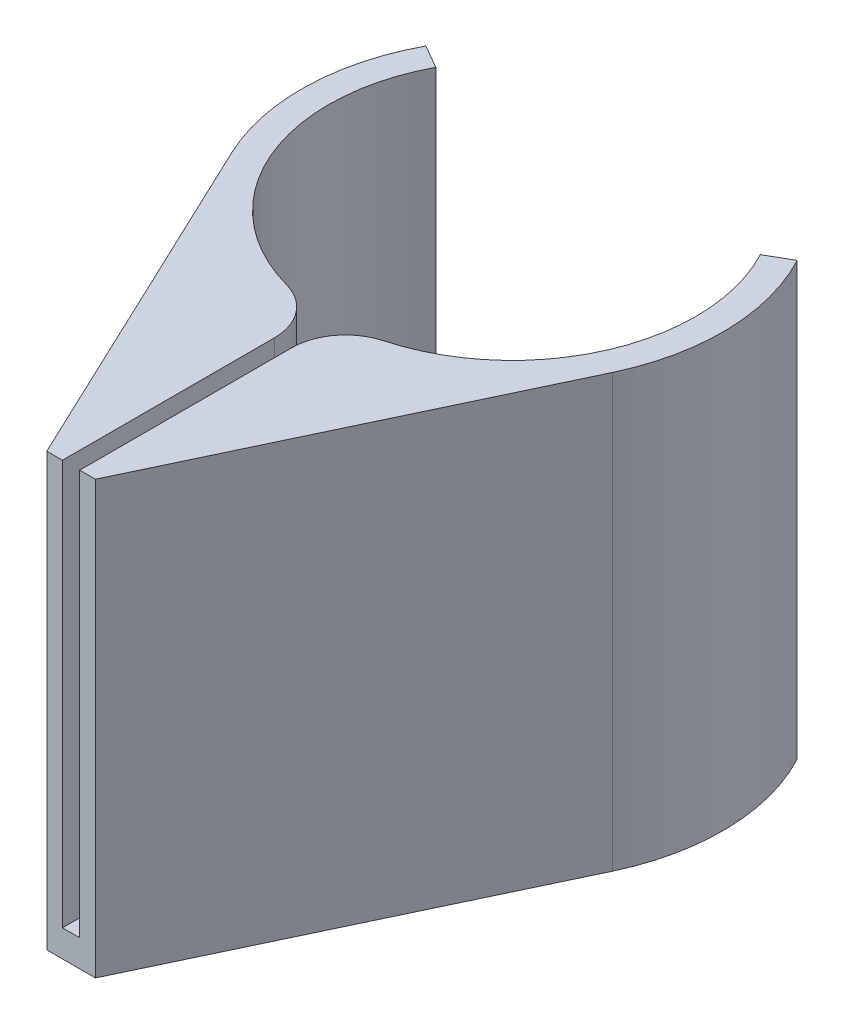
from build123d import *

# Parameters (mm, degrees)
FIN_SLOT_EXTRUDE_DEPTH = 80
FIN_START              = -75
FIN_SLOT_DEPTH         = 75
FILLET1_R              = 10


with BuildPart() as part:
    # Sketch2 → Fin slot extrude (new body)
    with BuildSketch(Plane(origin=(0, 0, 0), x_dir=(1, 0, 0), z_dir=(0, 1, 0))):
        with BuildLine():
            Line((-35.253910446, -16.678183302), (-4.5, -81.685))
            Line((-4.5, -81.685), (4.5, -81.685))
            Line((4.5, -81.685), (35.253910446, -16.678183302))
            ThreePointArc((35.253910446, -16.678183302), (38.987980591, 0.968178408), (34.382638025, 18.407449646))
            Line((34.382638025, 18.407449646), (30.049957519, 15.90597539))
            ThreePointArc((30.049957519, 15.90597539), (0, -34), (-30.049957519, 15.90597539))
            Line((-30.049957519, 15.90597539), (-34.382638025, 18.407449646))
            ThreePointArc((-34.382638025, 18.407449646), (-38.987980591, 0.968178408), (-35.253910446, -16.678183302))
        make_face()
    extrude(amount=FIN_SLOT_EXTRUDE_DEPTH)

    # Sketch3 → Fin slot (cut)
    with BuildSketch(Plane(origin=(0, 80, 0), x_dir=(1, 0, 0), z_dir=(0, 1, 0)).offset(FIN_START)):
        with BuildLine():
            Line((1.6, -81.685), (1.6, -33.962332075))
            ThreePointArc((1.6, -33.962332075), (0, -34), (-1.6, -33.962332075))
            Line((-1.6, -33.962332075), (-1.6, -81.685))
            Line((-1.6, -81.685), (1.6, -81.685))
        make_face()
    extrude(amount=FIN_SLOT_DEPTH, mode=Mode.SUBTRACT)

    # Fillet1
    # the kernel refuses this fillet: 10 mm, written as the material it takes off along each edge
    with BuildSketch(Plane(origin=(-1.6, 5, 33.962332075), x_dir=(0, 0, 1), z_dir=(0, 1, 0))) as fillet1_piece_1:
        with BuildLine():
            CenterArc((8.481041966, -10), FILLET1_R, 90, 74.714058958)
            Line((-1.165179407, -7.363636364), (-1.358103835, -7.310909091))
            ThreePointArc((-1.358103835, -7.310909091), (-0.577691759, -3.682593204), (-0.199778424, 0.009411765))
            Line((-0.199778424, 0.009411765), (0, 0.2))
            Line((0, 0.2), (8.481041966, 0.2))
            Line((8.481041966, 0.2), (8.481041966, 0))
        make_face()
    extrude(amount=75, mode=Mode.SUBTRACT)
    with BuildSketch(Plane(origin=(1.6, 5, 33.962332075), x_dir=(0, 0, 1), z_dir=(0, 1, 0))) as fillet1_piece_2:
        with BuildLine():
            CenterArc((8.481041966, 10), FILLET1_R, 195.285941042, 74.714058958)
            Line((-1.165179407, 7.363636364), (-1.358103835, 7.310909091))
            ThreePointArc((-1.358103835, 7.310909091), (-0.577691759, 3.682593204), (-0.199778424, -0.009411765))
            Line((-0.199778424, -0.009411765), (0, -0.2))
            Line((0, -0.2), (8.481041966, -0.2))
            Line((8.481041966, -0.2), (8.481041966, 0))
        make_face()
    extrude(amount=75, mode=Mode.SUBTRACT)
    with BuildSketch(Plane(origin=(0, 5, 0), x_dir=(0.7049632922211216, 0, 0.7092437920918008), z_dir=(0.7092437920918008, 0, -0.7049632922211216))) as fillet1_piece_3_section:
        with BuildLine():
            CenterArc((34 + FILLET1_R, FILLET1_R), FILLET1_R, 180, 90)
            Line((34, FILLET1_R), (34 - FILLET1_R * 0.02, FILLET1_R))
            Line((34 - FILLET1_R * 0.02, FILLET1_R), (34 - FILLET1_R * 0.02, -FILLET1_R * 0.02))
            Line((34 - FILLET1_R * 0.02, -FILLET1_R * 0.02), (34 + FILLET1_R, -FILLET1_R * 0.02))
            Line((34 + FILLET1_R, -FILLET1_R * 0.02), (34 + FILLET1_R, 0))
        make_face()
    fillet1_piece_3 = revolve(axis=Axis((0, 5, 0), (0, -1, 0)), revolution_arc=89.653157122, mode=Mode.PRIVATE)
    fillet1_piece_3 = split(fillet1_piece_3, bisect_by=Plane(origin=(1.6, 2.736001805, 36.252063161), z_dir=(-1, 0, 0)), keep=Keep.TOP, mode=Mode.PRIVATE)
    fillet1_piece_3 = split(fillet1_piece_3, bisect_by=Plane(origin=(-1.6, 2.736001805, 36.252063161), z_dir=(1, 0, 0)), keep=Keep.TOP, mode=Mode.PRIVATE)
    add(fillet1_piece_3, mode=Mode.SUBTRACT)
    with BuildSketch(Plane(origin=(0, 5, 0), x_dir=(0.7049632922211216, 0, 0.7092437920918008), z_dir=(0.7092437920918008, 0, -0.7049632922211216))) as fillet1_piece_4a_section:
        with BuildLine():
            CenterArc((34 + FILLET1_R, FILLET1_R), FILLET1_R, 180, 90)
            Line((34, FILLET1_R), (34 - FILLET1_R * 0.02, FILLET1_R))
            Line((34 - FILLET1_R * 0.02, FILLET1_R), (34 - FILLET1_R * 0.02, -FILLET1_R * 0.02))
            Line((34 - FILLET1_R * 0.02, -FILLET1_R * 0.02), (34 + FILLET1_R, -FILLET1_R * 0.02))
            Line((34 + FILLET1_R, -FILLET1_R * 0.02), (34 + FILLET1_R, 0))
        make_face()
    fillet1_piece_4a = revolve(axis=Axis((0, 5, 0), (0, -1, 0)), revolution_arc=89.653157122, mode=Mode.PRIVATE)
    fillet1_piece_4a = split(fillet1_piece_4a, bisect_by=Plane(origin=(-1.6, 2.81629174, 32.584573329), z_dir=(-1, 0, 0)), keep=Keep.TOP, mode=Mode.PRIVATE)
    with BuildSketch(Plane(origin=(-1.6, -16.202604914, 33.962332075), x_dir=(0, 0, 1), z_dir=(0, 1, 0))) as fillet1_piece_4b_section:
        with BuildLine():
            CenterArc((8.481041966, -10), FILLET1_R, 90, 74.714058958)
            Line((-1.165179407, -7.363636364), (-1.358103835, -7.310909091))
            ThreePointArc((-1.358103835, -7.310909091), (-0.577691759, -3.682593204), (-0.199778424, 0.009411765))
            Line((-0.199778424, 0.009411765), (0, 0.2))
            Line((0, 0.2), (8.481041966, 0.2))
            Line((8.481041966, 0.2), (8.481041966, 0))
        make_face()
    fillet1_piece_4b = extrude(amount=96.202604914, mode=Mode.PRIVATE)
    fillet1_piece_4b = split(fillet1_piece_4b, bisect_by=Plane(origin=(-3.235617235, 5, 35.755925785), z_dir=(0, -1, 0)), keep=Keep.TOP, mode=Mode.PRIVATE)
    fillet1_piece_4 = fillet1_piece_4a & fillet1_piece_4b
    add(fillet1_piece_4, mode=Mode.SUBTRACT)
    with BuildSketch(Plane(origin=(1.6, -16.202604914, 33.962332075), x_dir=(0, 0, 1), z_dir=(0, 1, 0))) as fillet1_piece_5a_section:
        with BuildLine():
            CenterArc((8.481041966, 10), FILLET1_R, 195.285941042, 74.714058958)
            Line((-1.165179407, 7.363636364), (-1.358103835, 7.310909091))
            ThreePointArc((-1.358103835, 7.310909091), (-0.577691759, 3.682593204), (-0.199778424, -0.009411765))
            Line((-0.199778424, -0.009411765), (0, -0.2))
            Line((0, -0.2), (8.481041966, -0.2))
            Line((8.481041966, -0.2), (8.481041966, 0))
        make_face()
    fillet1_piece_5a = extrude(amount=96.202604914, mode=Mode.PRIVATE)
    fillet1_piece_5a = split(fillet1_piece_5a, bisect_by=Plane(origin=(3.235617235, 5, 35.755925785), z_dir=(0, -1, 0)), keep=Keep.TOP, mode=Mode.PRIVATE)
    with BuildSketch(Plane(origin=(0, 5, 0), x_dir=(0.7049632922211216, 0, 0.7092437920918008), z_dir=(0.7092437920918008, 0, -0.7049632922211216))) as fillet1_piece_5b_section:
        with BuildLine():
            CenterArc((34 + FILLET1_R, FILLET1_R), FILLET1_R, 180, 90)
            Line((34, FILLET1_R), (34 - FILLET1_R * 0.02, FILLET1_R))
            Line((34 - FILLET1_R * 0.02, FILLET1_R), (34 - FILLET1_R * 0.02, -FILLET1_R * 0.02))
            Line((34 - FILLET1_R * 0.02, -FILLET1_R * 0.02), (34 + FILLET1_R, -FILLET1_R * 0.02))
            Line((34 + FILLET1_R, -FILLET1_R * 0.02), (34 + FILLET1_R, 0))
        make_face()
    fillet1_piece_5b = revolve(axis=Axis((0, 5, 0), (0, -1, 0)), revolution_arc=89.653157122, mode=Mode.PRIVATE)
    fillet1_piece_5b = split(fillet1_piece_5b, bisect_by=Plane(origin=(1.6, 2.816291902, 32.584573464), z_dir=(1, 0, 0)), keep=Keep.TOP, mode=Mode.PRIVATE)
    fillet1_piece_5 = fillet1_piece_5a & fillet1_piece_5b
    add(fillet1_piece_5, mode=Mode.SUBTRACT)


solid = part.part
